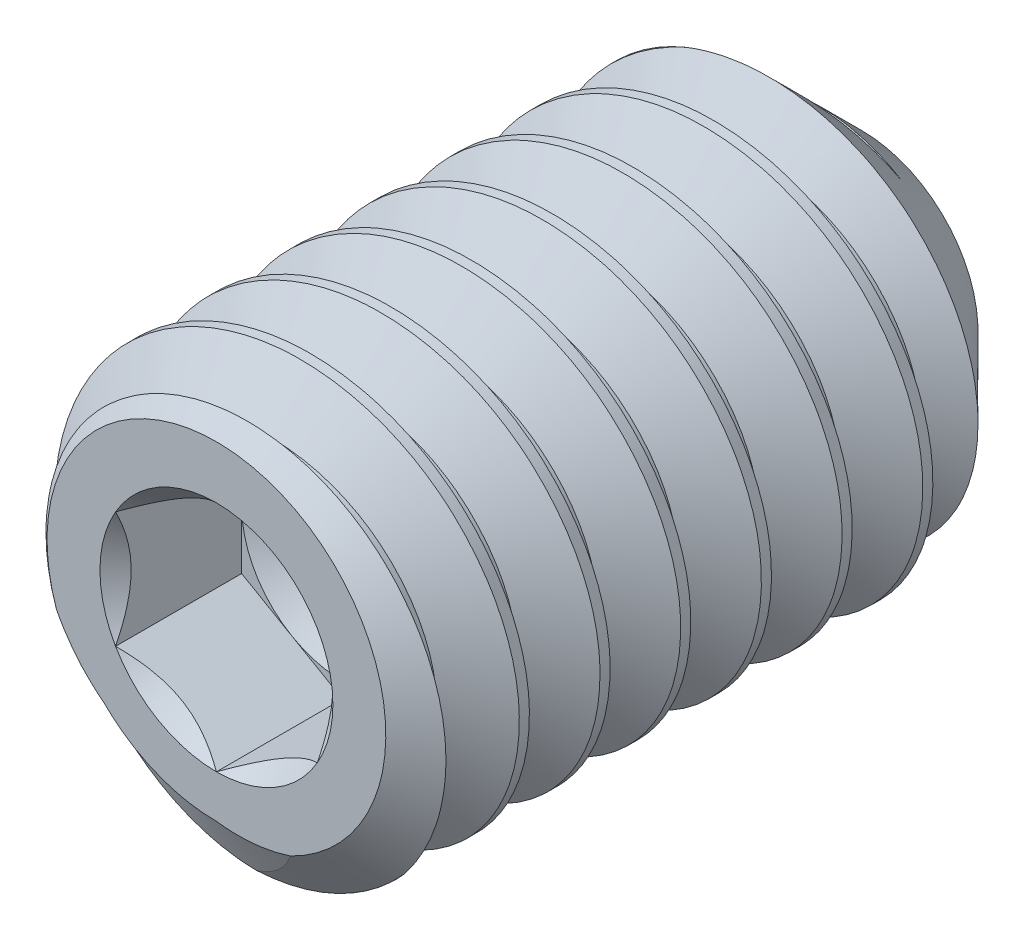
from build123d import *

# Parameters (mm, degrees)
CUT_SWEEP2_PITCH    = 0.79375
CUT_EXTRUDE10_DEPTH = 1.240234375


with BuildPart() as part:
    # Sketch22 → Revolve1 (revolve)
    with BuildSketch(Plane(origin=(0, 0, 0), x_dir=(0, 0, -1), z_dir=(1, 0, 0)), mode=Mode.PRIVATE) as revolve1_sk:
        Polygon((-2.832118495, 0), (-2.832118495, 1.66624), (-2.540440043, 2.0828), (2.576382812, 2.0828), (3.517881505, 1.141301307), (2.832118495, 0), align=None)
    revolve(revolve1_sk.sketch.rotate(Axis((0, 0, -2.832118495), (0, 0, -1)), 180), axis=Axis((0, 0, -2.832118495), (0, 0, -1)))

    # Cut-Sweep2: the profile of Sketch28 profile screwed along a right-hand helix of 9 turns, 8 arcs to a turn; built about Z, then put on its axis
    cut_sweep2_z = Axis((0, 0, 0), (0, 0, 1))
    cut_sweep2_corners = [(2.0831, 0, 0.000173205), (2.0831, 0, -0.694704455), (1.567244252, 0, -0.396875), (1.567244252, 0, -0.29765625)]
    with BuildLine(mode=Mode.PRIVATE) as cut_sweep2_profile:
        Line(cut_sweep2_corners[0], cut_sweep2_corners[1])
        Line(cut_sweep2_corners[1], cut_sweep2_corners[2])
        Line(cut_sweep2_corners[2], cut_sweep2_corners[3])
        Line(cut_sweep2_corners[3], cut_sweep2_corners[0])
    cut_sweep2_cap = Face(cut_sweep2_profile.wire())
    cut_sweep2_turn_angles = [0, 22.5, 45, 67.5, 90, 112.5, 135, 157.5, 180, 202.5, 225, 247.5, 270, 292.5, 315, 337.5, 360]
    cut_sweep2_turn_weights = [1, 0.9238795325112867, 1, 0.9238795325112867, 1, 0.9238795325112867, 1, 0.9238795325112867, 1, 0.9238795325112867, 1, 0.9238795325112867, 1, 0.9238795325112867, 1, 0.9238795325112867, 1]
    cut_sweep2_turn_rails = [Edge.make_bspline([Vector(p[0], p[1], 0).rotate(cut_sweep2_z, cut_sweep2_turn_angles[k]) / cut_sweep2_turn_weights[k] + Vector(0, 0, p[2] + CUT_SWEEP2_PITCH * cut_sweep2_turn_angles[k] / 360) for k in range(17)], [0, 0, 0, 1, 1, 2, 2, 3, 3, 4, 4, 5, 5, 6, 6, 7, 7, 8, 8, 8], 2, cut_sweep2_turn_weights) for p in cut_sweep2_corners]
    cut_sweep2_turn_sides = [Face.make_surface_from_curves(cut_sweep2_turn_rails[p[0]], cut_sweep2_turn_rails[p[1]]) for p in [(0, 1), (1, 2), (2, 3), (3, 0)]]
    cut_sweep2 = Plane(origin=(0, 0, -3.517881505), x_dir=(0, 1, 0), z_dir=(0, 0, 1)) * Solid(Shell([*[p.moved(Location((0, 0, CUT_SWEEP2_PITCH * i))) for i in range(9) for p in cut_sweep2_turn_sides], cut_sweep2_cap, cut_sweep2_cap.rotate(cut_sweep2_z, 3240).moved(Location((0, 0, CUT_SWEEP2_PITCH * 3240 / 360)))]))
    add(cut_sweep2, mode=Mode.SUBTRACT)

    # Sketch23 → Cut-Extrude10 (cut)
    with BuildSketch(Plane.XY.offset(2.832118495)):
        Polygon((0, 1.14567944), (-0.9921875, 0.57283972), (-0.9921875, -0.57283972), (0, -1.14567944), (0.9921875, -0.57283972), (0.9921875, 0.57283972), align=None)
    extrude(amount=-CUT_EXTRUDE10_DEPTH, mode=Mode.SUBTRACT)

    # Cut-Extrude11 cone 1 section (through the dimple's axis) → Cut-Extrude11 (revolve, cut)
    with BuildSketch(Plane(origin=(0, 0, 2.832118495), x_dir=(0, -1, 0), z_dir=(1, 0, 0))):
        Polygon((0, 0), (1.14567944, 0), (0, 1.14567944), align=None)
    revolve(axis=Axis((0, 0, 2.832118495), (0, 0, -1)), mode=Mode.SUBTRACT)

    # Cut-Extrude12 cone 1 section (through the dimple's axis) → Cut-Extrude12 (revolve, cut)
    with BuildSketch(Plane(origin=(0, 0, 1.59188412), x_dir=(0, -1, 0), z_dir=(1, 0, 0))):
        Polygon((0, 0), (0.9921875, 0), (0, 0.57283972), align=None)
    revolve(axis=Axis((0, 0, 1.59188412), (0, 0, -1)), mode=Mode.SUBTRACT)


solid = part.part
